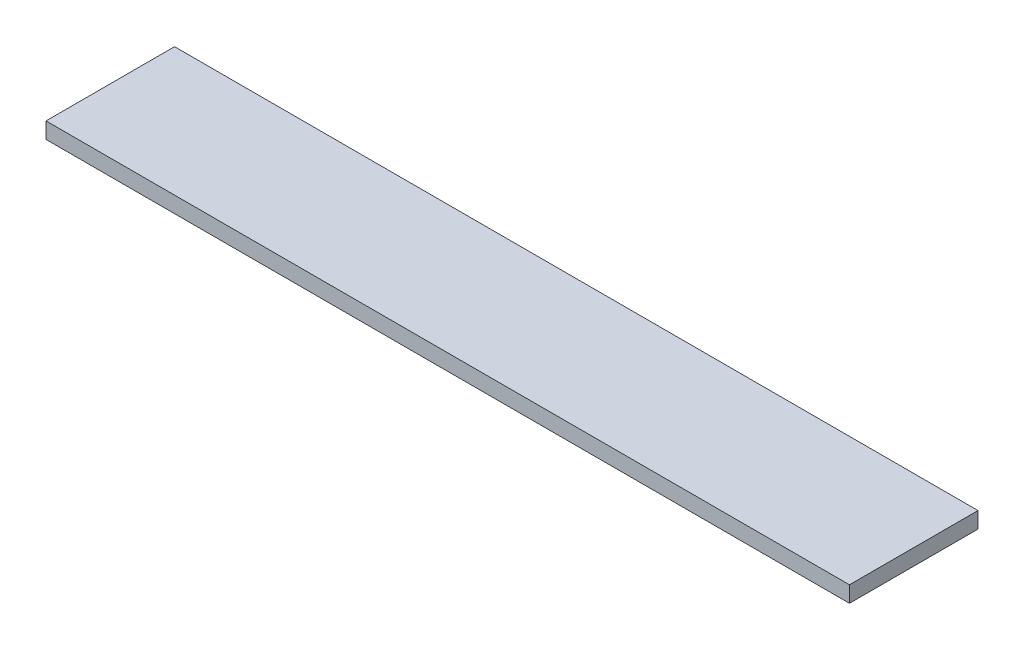
from build123d import *

# Parameters (mm, degrees)
SKETCH1_W           = 317.5
SKETCH1_H           = 50.8
BOSS_EXTRUDE1_DEPTH = 6.35


with BuildPart() as part:
    # Sketch1 → Boss-Extrude1 (new body)
    with BuildSketch(Plane(origin=(0, 0, 0), x_dir=(1, 0, 0), z_dir=(0, 1, 0))):
        with Locations((158.75, 25.4)):
            Rectangle(SKETCH1_W, SKETCH1_H)
    extrude(amount=BOSS_EXTRUDE1_DEPTH)


solid = part.part
